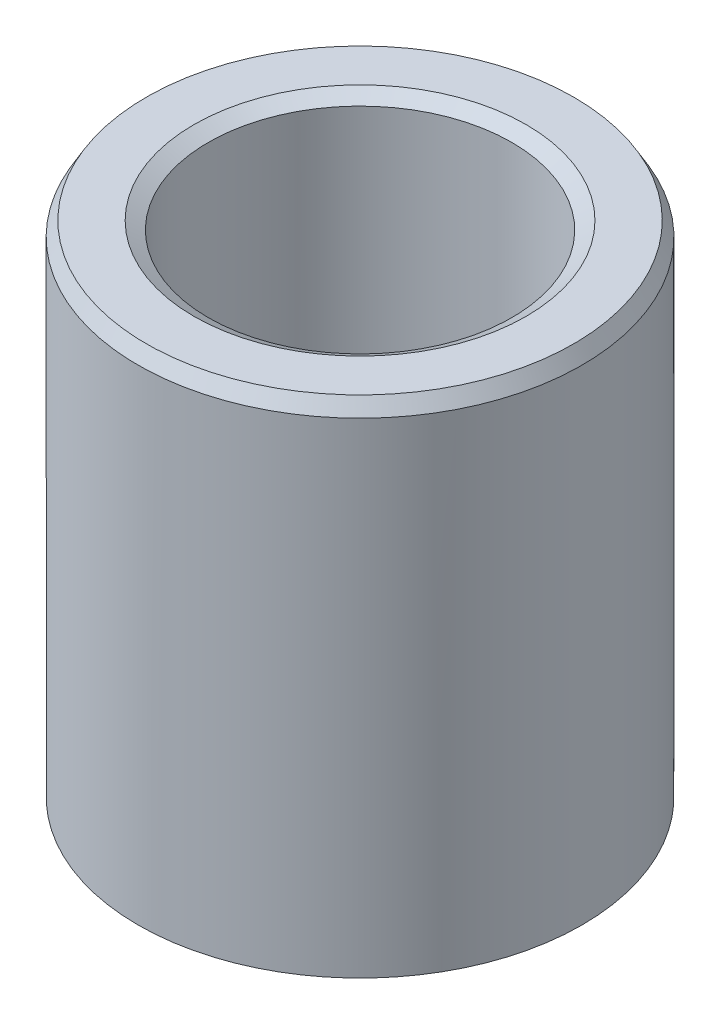
from build123d import *
from OCP.BRepFilletAPI import BRepFilletAPI_MakeChamfer

# Parameters (mm, degrees)
SKETCH1_R           = 45
BOSS_EXTRUDE1_DEPTH = 102.878784981
SKETCH2_R           = 30.775159014
CUT_EXTRUDE1_DEPTH  = 121.971254433
CHAMFER1_SIZE       = 2.903230721
CHAMFER1_SIZE2      = 1.676181038


with BuildPart() as part:
    # Sketch1 → Boss-Extrude1 (new body)
    with BuildSketch(Plane(origin=(0, 0, 0), x_dir=(1, 0, 0), z_dir=(0, 1, 0))):
        Circle(SKETCH1_R)
    extrude(amount=BOSS_EXTRUDE1_DEPTH)

    # Sketch2 → Cut-Extrude1 (cut, through all)
    with BuildSketch(Plane(origin=(0, 0, 0), x_dir=(1, 0, 0), z_dir=(0, 1, 0))):
        Circle(SKETCH2_R)
    extrude(amount=CUT_EXTRUDE1_DEPTH, mode=Mode.SUBTRACT)

    # Chamfer1: one chamfer whose edges measure the first distance from different faces: ONE call of the kernel's chamfer builder (chamfer() names one face for all edges)
    chamfer1_edges_1 = [part.edges().sort_by_distance(p)[0] for p in [
        (-30.775159014, 102.878784981, 0),
    ]]
    chamfer1_side_1 = [part.faces().sort_by_distance(p)[0] for p in [
        (-43.727207794, 102.878784981, 0),
    ]]
    chamfer1_edges_2 = [part.edges().sort_by_distance(p)[0] for p in [
        (-30.775159014, 0, 0),
    ]]
    chamfer1_side_2 = [part.faces().sort_by_distance(p)[0] for p in [
        (-30.775159014, 51.43939249, 0),
    ]]
    chamfer1_edges_3 = [part.edges().sort_by_distance(p)[0] for p in [
        (-45, 0, 0),
    ]]
    chamfer1_side_3 = [part.faces().sort_by_distance(p)[0] for p in [
        (-43.727207794, 0, 0),
    ]]
    chamfer1_edges_4 = [part.edges().sort_by_distance(p)[0] for p in [
        (-45, 102.878784981, 0),
    ]]
    chamfer1_side_4 = [part.faces().sort_by_distance(p)[0] for p in [
        (-45, 51.43939249, 0),
    ]]
    chamfer1 = BRepFilletAPI_MakeChamfer(part.part.solid().wrapped)
    for e in chamfer1_edges_1:
        chamfer1.Add(CHAMFER1_SIZE, CHAMFER1_SIZE2, e.wrapped, chamfer1_side_1[0].wrapped)  # the first distance lies on this face
    for e in chamfer1_edges_2:
        chamfer1.Add(CHAMFER1_SIZE, CHAMFER1_SIZE2, e.wrapped, chamfer1_side_2[0].wrapped)  # the first distance lies on this face
    for e in chamfer1_edges_3:
        chamfer1.Add(CHAMFER1_SIZE, CHAMFER1_SIZE2, e.wrapped, chamfer1_side_3[0].wrapped)  # the first distance lies on this face
    for e in chamfer1_edges_4:
        chamfer1.Add(CHAMFER1_SIZE, CHAMFER1_SIZE2, e.wrapped, chamfer1_side_4[0].wrapped)  # the first distance lies on this face
    add(Compound.cast(chamfer1.Shape()), mode=Mode.REPLACE)


solid = part.part
